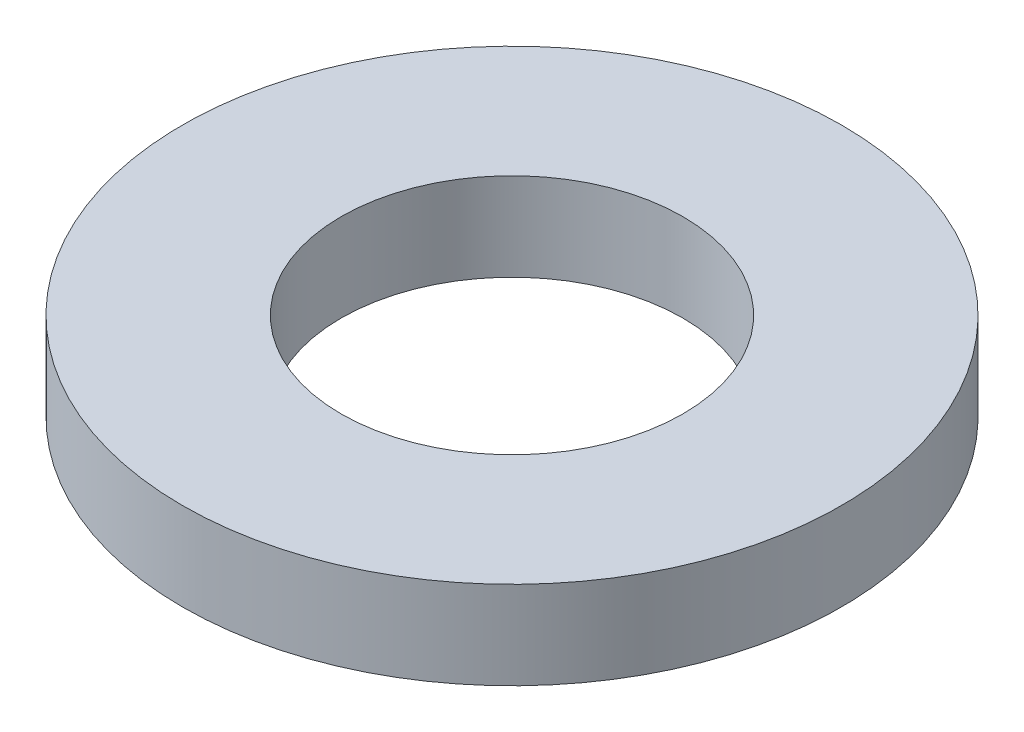
from build123d import *

# Parameters (mm, degrees)
SKETCH1_R           = 67.5
BOSS_EXTRUDE1_DEPTH = 18
SKETCH2_R           = 35
CUT_EXTRUDE1_DEPTH  = 98.141649152


with BuildPart() as part:
    # Sketch1 → Boss-Extrude1 (new body)
    with BuildSketch(Plane(origin=(0, 0, 0), x_dir=(1, 0, 0), z_dir=(0, 1, 0))):
        Circle(SKETCH1_R)
    extrude(amount=BOSS_EXTRUDE1_DEPTH)

    # Sketch2 → Cut-Extrude1 (cut, through all)
    with BuildSketch(Plane(origin=(0, 0, 0), x_dir=(1, 0, 0), z_dir=(0, 1, 0))):
        Circle(SKETCH2_R)
    extrude(amount=CUT_EXTRUDE1_DEPTH, mode=Mode.SUBTRACT)


solid = part.part
